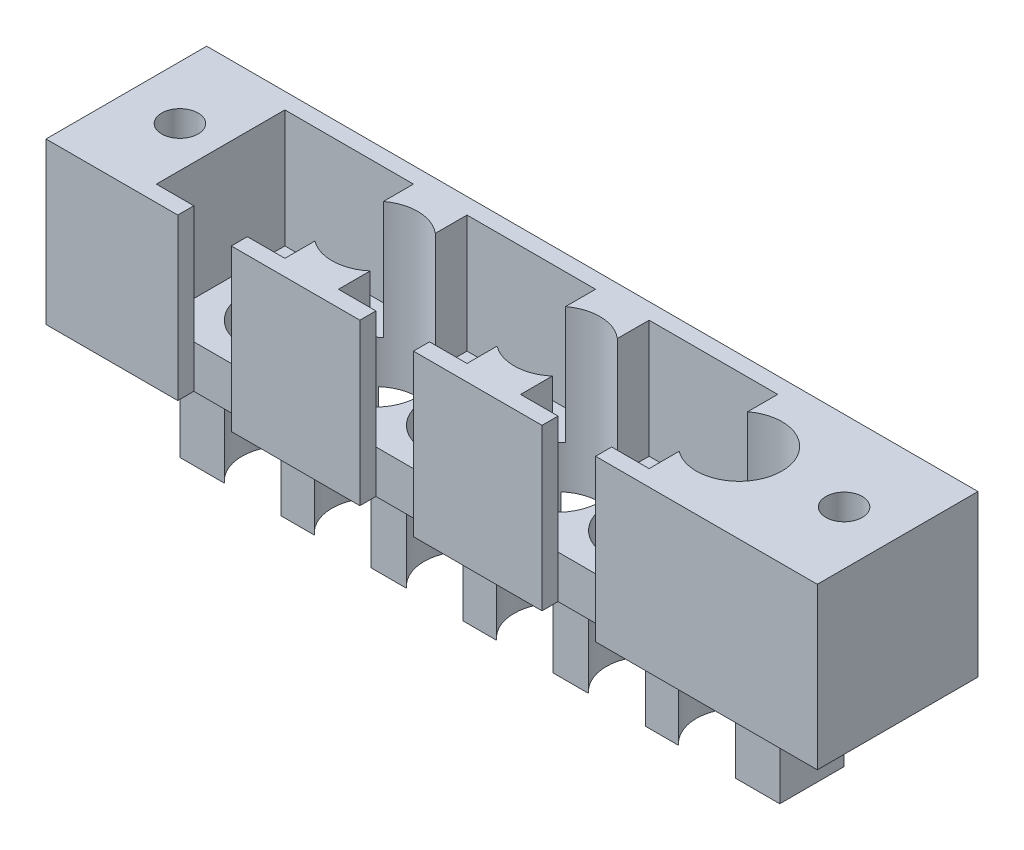
from build123d import *

# Parameters (mm, degrees)
SKETCH1_W               = 12
SKETCH1_H               = 12
SKETCH1_R               = 4
BOSS_EXTRUDE1_DEPTH     = 4
BOSS_EXTRUDE1_2_DEPTH   = 4
BOSS_EXTRUDE1_3_DEPTH   = 4
BOSS_EXTRUDE2_OUTLINE_R = 1.7
BOSS_EXTRUDE2_DEPTH     = 15
CUT_EXTRUDE1_DEPTH      = 63.45480038
CUT_EXTRUDE2_DEPTH      = 1
BOSS_EXTRUDE4_DEPTH     = 9


# Read off the part's stored shape, not the designer's step: Boss-Extrude2
with BuildPart() as part:
    # Sketch1 → Boss-Extrude1 (new body)
    with BuildSketch(Plane(origin=(0, 0, 0), x_dir=(1, 0, 0), z_dir=(0, 1, 0))):
        with Locations((-1.865268271, -17.272354652)):
            Rectangle(SKETCH1_W, SKETCH1_H)
        with Locations(Location((-1.865268271, -17.272354652, 0), (0, 0, 270))):
            Circle(SKETCH1_R, mode=Mode.SUBTRACT)
    extrude(amount=BOSS_EXTRUDE1_DEPTH)



with BuildPart() as body_2:
    # Sketch1 → Boss-Extrude1 2 (new body)
    with BuildSketch(Plane(origin=(0, 0, 0), x_dir=(1, 0, 0), z_dir=(0, 1, 0))):
        with Locations((15.134732638, -17.272354652)):
            Rectangle(SKETCH1_W, SKETCH1_H)
        with Locations(Location((15.134732638, -17.272354652, 0), (0, 0, 270))):
            Circle(SKETCH1_R, mode=Mode.SUBTRACT)
    extrude(amount=BOSS_EXTRUDE1_2_DEPTH)


with BuildPart() as body_3:
    # Sketch1 → Boss-Extrude1 3 (new body)
    with BuildSketch(Plane(origin=(0, 0, 0), x_dir=(1, 0, 0), z_dir=(0, 1, 0))):
        with Locations((32.134732638, -17.272355561)):
            Rectangle(SKETCH1_W, SKETCH1_H)
        with Locations(Location((32.134732638, -17.272355561, 0), (0, 0, 270))):
            Circle(SKETCH1_R, mode=Mode.SUBTRACT)
    extrude(amount=BOSS_EXTRUDE1_3_DEPTH)


with BuildPart() as part_1:
    add(part.part)

    add(body_2.part)  # Boss-Extrude2 merges body 2

    add(body_3.part)  # Boss-Extrude2 merges body 3
    # Boss-Extrude2 outline → Boss-Extrude2 (add)
    with BuildSketch(Plane(origin=(0, 0, 0), x_dir=(1, 0, 0), z_dir=(0, 1, 0))):
        Polygon((38.134732638, -11.272355561), (38.134732638, -23.272355561), (34.634731729, -23.272355561), (34.634731729, -24.772354652), (55.334731729, -24.772354652), (55.334731729, -9.772354652), (-16.665268271, -9.772354652), (-16.665268271, -24.772354652), (-4.365268271, -24.772354652), (-4.365268271, -23.272354652), (-7.865268271, -23.272354652), (-7.865268271, -11.272354652), (4.134731729, -11.272354652), (4.134731729, -23.272354652), (0.634731729, -23.272354652), (0.634731729, -24.772354652), (12.634731729, -24.772354652), (12.634731729, -23.272354652), (9.134732638, -23.272354652), (9.134732638, -11.272354652), (21.134732638, -11.272354652), (21.134732638, -23.272354652), (17.634731729, -23.272354652), (17.634731729, -24.772354652), (29.634731729, -24.772354652), (29.634731729, -23.272355561), (26.134732638, -23.272355561), (26.134732638, -11.272355561), align=None)
        with Locations((-11.665268271, -17.272354652)):
            Circle(BOSS_EXTRUDE2_OUTLINE_R, mode=Mode.SUBTRACT)
        with Locations((50.334731729, -17.272354652)):
            Circle(BOSS_EXTRUDE2_OUTLINE_R, mode=Mode.SUBTRACT)
    extrude(amount=BOSS_EXTRUDE2_DEPTH)

    # Sketch4 → Cut-Extrude1 (cut, through all)
    with BuildSketch(Plane(origin=(0, 15, 0), x_dir=(1, 0, 0), z_dir=(0, 1, 0))):
        with BuildLine():
            ThreePointArc((4.134731729, -20.472354652), (6.662877053, -21.270301472), (9.134732638, -20.312090706))
            Line((9.134732638, -20.312090706), (9.134732638, -14.232618599))
            ThreePointArc((9.134732638, -14.232618599), (6.662877053, -13.274407832), (4.134731729, -14.072354652))
            Line((4.134731729, -14.072354652), (4.134731729, -20.472354652))
        make_face()
        with BuildLine():
            ThreePointArc((21.134732638, -20.472354652), (23.662877364, -21.270301491), (26.134732638, -20.312091483))
            Line((26.134732638, -20.312091483), (26.134732638, -14.232617821))
            ThreePointArc((26.134732638, -14.232617821), (23.662877364, -13.274407813), (21.134732638, -14.072354652))
            Line((21.134732638, -14.072354652), (21.134732638, -20.472354652))
        make_face()
        with BuildLine():
            Line((38.134732638, -14.072354652), (38.134732638, -20.472354652))
            ThreePointArc((38.134732638, -20.472354652), (42.32358702, -20.850063416), (44.534732638, -17.272354652))
            ThreePointArc((44.534732638, -17.272354652), (42.32358702, -13.694645888), (38.134732638, -14.072354652))
        make_face()
        with BuildLine():
            ThreePointArc((38.134732638, -14.072354652), (36.534732638, -17.272354652), (38.134732638, -20.472354652))
            Line((38.134732638, -20.472354652), (38.134732638, -14.072354652))
        make_face()
        with BuildLine():
            ThreePointArc((4.134731729, -14.072354652), (2.534731729, -17.272354652), (4.134731729, -20.472354652))
            Line((4.134731729, -20.472354652), (4.134731729, -14.072354652))
        make_face()
        with BuildLine():
            Line((9.134732638, -14.232618599), (9.134732638, -20.312090706))
            ThreePointArc((9.134732638, -20.312090706), (10.167912404, -18.945674162), (10.534731729, -17.272354652))
            ThreePointArc((10.534731729, -17.272354652), (10.167912404, -15.599035142), (9.134732638, -14.232618599))
        make_face()
        with BuildLine():
            ThreePointArc((21.134732638, -14.072354652), (19.534732638, -17.272354652), (21.134732638, -20.472354652))
            Line((21.134732638, -20.472354652), (21.134732638, -14.072354652))
        make_face()
        with BuildLine():
            Line((26.134732638, -14.232617821), (26.134732638, -20.312091483))
            ThreePointArc((26.134732638, -20.312091483), (27.167913063, -18.945674705), (27.534732638, -17.272354652))
            ThreePointArc((27.534732638, -17.272354652), (27.167913063, -15.599034599), (26.134732638, -14.232617821))
        make_face()
    extrude(amount=-CUT_EXTRUDE1_DEPTH, mode=Mode.SUBTRACT)

    # Sketch3 → Cut-Extrude2 (cut)
    # profile 1 of 3: a face of its own
    with BuildSketch(Plane.XZ):
        Polygon((-13.748180739, 23.672817735), (-12.201385867, 23.672817735), (-12.201385867, 23.347176709), (-13.463244841, 23.347176709), (-13.463244841, 22.370253632), (-12.201385867, 22.370253632), (-12.201385867, 22.044612607), (-13.463244841, 22.044612607), (-13.463244841, 20.497817735), (-13.748180739, 20.497817735), align=None)
    # profile 2 of 3: a face of its own
    with BuildSketch(Plane.XZ):
        Polygon((-11.241635266, 23.672817735), (-10.654590995, 23.672817735), (-10.654590995, 20.497817735), (-10.939526892, 20.497817735), (-10.939526892, 23.347176709), (-11.427988431, 23.347176709), align=None)
    # profile 3 of 3: a face of its own
    with BuildSketch(Plane.XZ):
        with BuildLine():
            add(Edge.make_bspline(
                [(-9.474142277, 22.0840457), (-9.473844718, 22.134934044), (-9.473266704, 22.233785387), (-9.466836494, 22.377825741), (-9.456154576, 22.512954003), (-9.441515674, 22.639176642), (-9.42370122, 22.756526242), (-9.399920029, 22.864689201), (-9.372875558, 22.964166129), (-9.341531554, 23.055281416), (-9.306164059, 23.139262618), (-9.267670123, 23.217662622), (-9.224522059, 23.290362804), (-9.17918586, 23.358523514), (-9.129826338, 23.421029008), (-9.077848149, 23.478761995), (-9.02122259, 23.530388176), (-8.961874575, 23.577420179), (-8.899266783, 23.618649342), (-8.835183793, 23.654964755), (-8.769184518, 23.68598892), (-8.701088766, 23.710382387), (-8.631508589, 23.730530798), (-8.56020075, 23.744309344), (-8.487047512, 23.752978825), (-8.437670425, 23.753807652), (-8.412628856, 23.754227991)],
                knots=[0, 0, 0, 0, 1.646270934, 3.197905019, 4.663502075, 6.030701355, 7.308322542, 8.50163776, 9.611534131, 10.641858119, 11.616356847, 12.558055219, 13.465016945, 14.349605745, 15.204443733, 16.039544428, 16.859896111, 17.680448484, 18.487036065, 19.28249412, 20.06191084, 20.843045899, 21.620316918, 22.403196591, 23.190181807, 24, 24, 24, 24], degree=3))
            add(Edge.make_bspline(
                [(-8.412628856, 23.754227991), (-8.3873781, 23.753785473), (-8.337162292, 23.752905444), (-8.26292138, 23.744447296), (-8.190395598, 23.730412778), (-8.119894143, 23.710527322), (-8.050837905, 23.685856958), (-7.983767021, 23.654935073), (-7.918264883, 23.618940672), (-7.855372408, 23.576646155), (-7.79439915, 23.529490804), (-7.736842783, 23.476184669), (-7.68269807, 23.417265995), (-7.631285471, 23.353365162), (-7.584063608, 23.283256549), (-7.539093423, 23.208159535), (-7.498841648, 23.126760822), (-7.460075192, 23.04041854), (-7.426613426, 22.94674365), (-7.396436189, 22.846264189), (-7.372053125, 22.737793319), (-7.351742856, 22.621900154), (-7.336008558, 22.49815908), (-7.324548947, 22.366835351), (-7.318495505, 22.227842568), (-7.317355498, 22.132812233), (-7.316770482, 22.0840457)],
                knots=[0, 0, 0, 0, 0.810914788, 1.612654377, 2.396697861, 3.181598691, 3.963628158, 4.749916497, 5.551656086, 6.361998678, 7.18212741, 8.025565596, 8.878627764, 9.750805457, 10.657531673, 11.591944965, 12.560506719, 13.57287815, 14.630710178, 15.753379473, 16.941251878, 18.199788006, 19.531962791, 20.947069417, 22.433333509, 24, 24, 24, 24], degree=3))
            add(Edge.make_bspline(
                [(-7.316770482, 22.0840457), (-7.317361562, 22.035491869), (-7.318513258, 21.94088671), (-7.324481085, 21.802519325), (-7.336236415, 21.671892529), (-7.35094119, 21.548693038), (-7.371307421, 21.433433626), (-7.39634925, 21.325715448), (-7.424153471, 21.225073326), (-7.458475035, 21.132331747), (-7.496040465, 21.04619697), (-7.536911964, 20.965763199), (-7.580699592, 20.890319491), (-7.628405097, 20.820469721), (-7.67925355, 20.755719082), (-7.734333258, 20.697210524), (-7.792091575, 20.643534272), (-7.853244266, 20.595771724), (-7.917117602, 20.553966222), (-7.982394765, 20.516579372), (-8.050233977, 20.48643257), (-8.11909787, 20.460547212), (-8.189971459, 20.440771088), (-8.262766399, 20.427096947), (-8.337112413, 20.41750677), (-8.387369547, 20.416775178), (-8.412628856, 20.416407479)],
                knots=[0, 0, 0, 0, 1.561518951, 3.042555995, 4.452378317, 5.7783523, 7.031515105, 8.214008947, 9.334062868, 10.386615937, 11.391082383, 12.354592575, 13.286541444, 14.194233754, 15.072674879, 15.931287219, 16.775624067, 17.606195743, 18.42308326, 19.229000347, 20.022332153, 20.807536673, 21.593273796, 22.3848459, 23.188221202, 24, 24, 24, 24], degree=3))
            add(Edge.make_bspline(
                [(-8.412628856, 20.416407479), (-8.43766973, 20.41683053), (-8.487045448, 20.417664704), (-8.56020872, 20.426295017), (-8.631222079, 20.440170224), (-8.700435949, 20.459598143), (-8.76820543, 20.483378745), (-8.833607062, 20.514361015), (-8.897368032, 20.550042634), (-8.959318229, 20.590678481), (-9.018293547, 20.637234579), (-9.074625853, 20.688727898), (-9.126899977, 20.746443421), (-9.175553764, 20.809469823), (-9.221794544, 20.877227264), (-9.264329904, 20.95064086), (-9.303673465, 21.029419514), (-9.339635774, 21.11407219), (-9.371520633, 21.20583416), (-9.39968534, 21.305755201), (-9.421923183, 21.414717242), (-9.440957721, 21.531845139), (-9.456310554, 21.657642205), (-9.466791978, 21.792176732), (-9.47327017, 21.935364886), (-9.47384627, 22.033581038), (-9.474142277, 22.0840457)],
                knots=[0, 0, 0, 0, 0.810891512, 1.598919785, 2.382837074, 3.152667961, 3.926044502, 4.706494248, 5.493654104, 6.291793342, 7.103789334, 7.925228297, 8.761435821, 9.622817696, 10.50288917, 11.416980706, 12.369136599, 13.353924996, 14.394355917, 15.514179734, 16.714354668, 17.994756427, 19.357759367, 20.818452758, 22.365282078, 24, 24, 24, 24], degree=3))
        make_face()
        with BuildLine():
            add(Edge.make_bspline(
                [(-9.18920638, 22.085317735), (-9.189098024, 22.042909987), (-9.188887727, 21.960604875), (-9.183393888, 21.841004202), (-9.175909749, 21.729452547), (-9.166256572, 21.625808267), (-9.151921041, 21.530422185), (-9.135858454, 21.442638258), (-9.116311259, 21.36292105), (-9.093183635, 21.290723536), (-9.066841026, 21.224820452), (-9.038079278, 21.163496493), (-9.007181337, 21.106027236), (-8.972601822, 21.052928891), (-8.934941729, 21.0040283), (-8.895051701, 20.958459945), (-8.851442999, 20.917822683), (-8.791114604, 20.86908475), (-8.71147066, 20.818720965), (-8.611122104, 20.774864155), (-8.50800858, 20.747302926), (-8.438021375, 20.743797948), (-8.403088591, 20.742048504)],
                knots=[0, 0, 0, 0, 1.459021318, 2.831673884, 4.118529203, 5.306027144, 6.411944654, 7.436330062, 8.375795394, 9.233974572, 10.042671642, 10.816086306, 11.563610507, 12.285937304, 12.993564865, 13.685989202, 14.367179055, 15.041617293, 16.353048772, 17.594441528, 18.799311195, 20, 20, 20, 20], degree=3))
            add(Edge.make_bspline(
                [(-8.403088591, 20.742048504), (-8.367929846, 20.74349792), (-8.297684946, 20.746393758), (-8.195056432, 20.774332613), (-8.095424687, 20.816487124), (-8.017345141, 20.866332361), (-7.957943119, 20.913801631), (-7.915382707, 20.95427349), (-7.876319277, 20.999590599), (-7.839269681, 21.04848496), (-7.805288948, 21.101890713), (-7.774388816, 21.15955105), (-7.746191779, 21.221626089), (-7.730127144, 21.264960067), (-7.721913711, 21.287115612)],
                knots=[0, 0, 0, 0, 1.353760809, 2.704726607, 4.075137775, 5.516104923, 6.260822281, 7.007110065, 7.778089737, 8.566572457, 9.372053459, 10.217411131, 11.088608312, 12, 12, 12, 12], degree=3))
            add(Edge.make_bspline(
                [(-7.721913711, 21.287115612), (-7.712341751, 21.315445447), (-7.692906565, 21.372967161), (-7.667858741, 21.462197046), (-7.648132558, 21.555816696), (-7.63038579, 21.653266623), (-7.618272661, 21.755265495), (-7.608522859, 21.861497715), (-7.602780022, 21.972043379), (-7.60206814, 22.047150264), (-7.60170638, 22.085317735)],
                knots=[0, 0, 0, 0, 0.884706709, 1.796334032, 2.740027952, 3.714592787, 4.726048262, 5.777819803, 6.87074269, 8, 8, 8, 8], degree=3))
            add(Edge.make_bspline(
                [(-7.60170638, 22.085317735), (-7.60220548, 22.123479033), (-7.603181827, 22.19813069), (-7.606913801, 22.307457896), (-7.616550901, 22.411296508), (-7.627254387, 22.510093865), (-7.643036152, 22.603303068), (-7.660052163, 22.691704417), (-7.682913262, 22.774202732), (-7.707333344, 22.852089638), (-7.735282774, 22.924480232), (-7.76604919, 22.991712024), (-7.7989075, 23.054109596), (-7.834596532, 23.11150175), (-7.872692616, 23.164145557), (-7.91420125, 23.21098551), (-7.957475931, 23.253473331), (-8.018088664, 23.301971519), (-8.097440341, 23.351421414), (-8.196178893, 23.396928925), (-8.298931549, 23.423062162), (-8.368394611, 23.426746692), (-8.403088591, 23.428586966)],
                knots=[0, 0, 0, 0, 1.31362396, 2.569729283, 3.763502607, 4.902122613, 5.988968491, 7.01645872, 7.998833611, 8.933434873, 9.825090667, 10.667526885, 11.477055099, 12.250526234, 12.991942729, 13.710640831, 14.402115721, 15.076753259, 16.378508321, 17.609869233, 18.806226677, 20, 20, 20, 20], degree=3))
            add(Edge.make_bspline(
                [(-8.403088591, 23.428586966), (-8.438204628, 23.426744153), (-8.508500676, 23.423055172), (-8.61232132, 23.397026292), (-8.711838839, 23.351657387), (-8.79098068, 23.301807735), (-8.851635687, 23.254329409), (-8.894346416, 23.213157412), (-8.934393301, 23.168121167), (-8.971284714, 23.118770858), (-9.005837135, 23.065734418), (-9.037569911, 23.00859461), (-9.066160632, 22.947061872), (-9.092544461, 22.881188392), (-9.115742633, 22.808997106), (-9.134877871, 22.729378091), (-9.152555412, 22.641873374), (-9.165069692, 22.545970678), (-9.17619467, 22.442300439), (-9.183344179, 22.3304703), (-9.188906105, 22.210669041), (-9.189104283, 22.127938376), (-9.18920638, 22.085317735)],
                knots=[0, 0, 0, 0, 1.207732386, 2.417664972, 3.655092373, 4.956220595, 5.625982001, 6.301752483, 6.994047911, 7.697131622, 8.419323945, 9.170223765, 9.943494443, 10.752040957, 11.610060368, 12.549350801, 13.567764191, 14.679664412, 15.874934091, 17.154273443, 18.533957287, 20, 20, 20, 20], degree=3))
        make_face(mode=Mode.SUBTRACT)
    extrude(amount=-CUT_EXTRUDE2_DEPTH, mode=Mode.SUBTRACT)

    # Sketch5 → Boss-Extrude4 (add)
    with BuildSketch(Plane.XZ):
        with BuildLine():
            Line((-8.668139711, 14.272354652), (-4.511019582, 14.272354652))
            ThreePointArc((-4.511019582, 14.272354652), (-5.865268271, 17.272354652), (-4.511019582, 20.272354652))
            Line((-4.511019582, 20.272354652), (-8.668139711, 20.272354652))
            Line((-8.668139711, 20.272354652), (-8.668139711, 14.272354652))
        make_face()
        with BuildLine():
            ThreePointArc((2.134731729, 17.272354652), (1.78048304, 15.626603341), (0.78048304, 14.272354652))
            Line((0.78048304, 14.272354652), (3.888980418, 14.272354652))
            ThreePointArc((3.888980418, 14.272354652), (2.534731729, 17.272354652), (3.888980418, 20.272354652))
            Line((3.888980418, 20.272354652), (0.78048304, 20.272354652))
            ThreePointArc((0.78048304, 20.272354652), (1.78048304, 18.918105963), (2.134731729, 17.272354652))
        make_face()
        with BuildLine():
            ThreePointArc((10.534731729, 17.272354652), (10.18048304, 15.626603341), (9.18048304, 14.272354652))
            Line((9.18048304, 14.272354652), (12.488981327, 14.272354652))
            ThreePointArc((12.488981327, 14.272354652), (11.134732638, 17.272354652), (12.488981327, 20.272354652))
            Line((12.488981327, 20.272354652), (9.18048304, 20.272354652))
            ThreePointArc((9.18048304, 20.272354652), (10.18048304, 18.918105963), (10.534731729, 17.272354652))
        make_face()
        with BuildLine():
            ThreePointArc((19.134732638, 17.272354652), (18.780483949, 15.626603341), (17.780483949, 14.272354652))
            Line((17.780483949, 14.272354652), (20.888981327, 14.272354652))
            ThreePointArc((20.888981327, 14.272354652), (19.534732638, 17.272354652), (20.888981327, 20.272354652))
            Line((20.888981327, 20.272354652), (17.780483949, 20.272354652))
            ThreePointArc((17.780483949, 20.272354652), (18.780483949, 18.918105963), (19.134732638, 17.272354652))
        make_face()
        with BuildLine():
            ThreePointArc((27.534732638, 17.272354652), (27.180483949, 15.626603341), (26.180483949, 14.272354652))
            Line((26.180483949, 14.272354652), (29.488982357, 14.272354652))
            ThreePointArc((29.488982357, 14.272354652), (28.134732638, 17.272354187), (29.488980297, 20.272354652))
            Line((29.488980297, 20.272354652), (26.180483949, 20.272354652))
            ThreePointArc((26.180483949, 20.272354652), (27.180483949, 18.918105963), (27.534732638, 17.272354652))
        make_face()
        with BuildLine():
            ThreePointArc((36.134732638, 17.272355561), (35.780483666, 15.626603624), (34.780482919, 14.272354652))
            Line((34.780482919, 14.272354652), (37.888981327, 14.272354652))
            ThreePointArc((37.888981327, 14.272354652), (36.534732638, 17.272354652), (37.888981327, 20.272354652))
            Line((37.888981327, 20.272354652), (34.780484979, 20.272354652))
            ThreePointArc((34.780484979, 20.272354652), (35.780484232, 18.918106246), (36.134732638, 17.272355561))
        make_face()
        with BuildLine():
            ThreePointArc((44.534732638, 17.272354652), (44.180483949, 15.626603341), (43.180483949, 14.272354652))
            Line((43.180483949, 14.272354652), (44.334732638, 14.272354652))
            Line((44.334732638, 14.272354652), (47.330399458, 14.272354652))
            Line((47.330399458, 14.272354652), (47.330399458, 17.272354652))
            Line((47.330399458, 17.272354652), (47.330399458, 20.272354652))
            Line((47.330399458, 20.272354652), (44.334732638, 20.272354652))
            Line((44.334732638, 20.272354652), (43.180483949, 20.272354652))
            ThreePointArc((43.180483949, 20.272354652), (44.180483949, 18.918105963), (44.534732638, 17.272354652))
        make_face()
    extrude(amount=BOSS_EXTRUDE4_DEPTH)


solid = part_1.part
